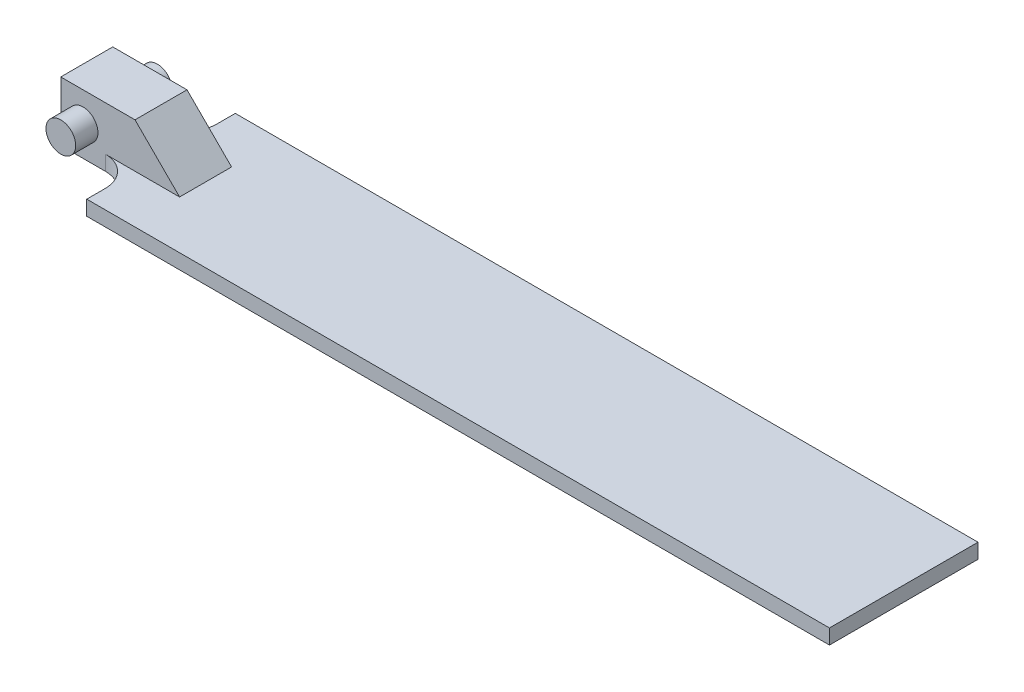
from build123d import *

# Parameters (mm, degrees)
SKETCH2_W           = 10
SKETCH2_H           = 7
BOSS_EXTRUDE1_DEPTH = 8
SKETCH3_R           = 2
BOSS_EXTRUDE2_DEPTH = 3
SKETCH4_W           = 20
SKETCH4_H           = 2
BOSS_EXTRUDE3_DEPTH = 100
CHAMFER1_SIZE       = 6
FILLET1_R           = 4


with BuildPart() as part:
    # Sketch2 → Boss-Extrude1 (new body)
    with BuildSketch(Plane(origin=(0, 0, 0), x_dir=(1, 0, 0), z_dir=(0, 1, 0))):
        with Locations((5, 0)):
            Rectangle(SKETCH2_W, SKETCH2_H)
    extrude(amount=BOSS_EXTRUDE1_DEPTH)

    # Sketch3 → Boss-Extrude2 (add)
    with BuildSketch(Plane.XY.offset(3.5)):
        with Locations((3.01, 4)):
            Circle(SKETCH3_R)
    boss_extrude2 = extrude(amount=BOSS_EXTRUDE2_DEPTH)

    # Mirror1: Boss-Extrude2 across plane
    add(boss_extrude2.mirror(Plane.XY))

    # Sketch4 → Boss-Extrude3 (add)
    with BuildSketch(Plane(origin=(10, 0, 0), x_dir=(0, 0, -1), z_dir=(1, 0, 0))):
        with Locations((0, 1)):
            Rectangle(SKETCH4_W, SKETCH4_H)
    extrude(amount=BOSS_EXTRUDE3_DEPTH)

    # Chamfer1
    chamfer1_edges = [part.edges().sort_by_distance(p)[0] for p in [
        (10, 2, 0),
    ]]
    chamfer(chamfer1_edges, length=CHAMFER1_SIZE - 0.0001)  # a hair under: the kernel refuses the full size

    # Fillet1
    fillet1_edges = [part.edges().sort_by_distance(p)[0] for p in [
        (10, 1, -3.5),
        (10, 1, 3.5),
    ]]
    fillet(fillet1_edges, radius=FILLET1_R)


solid = part.part
